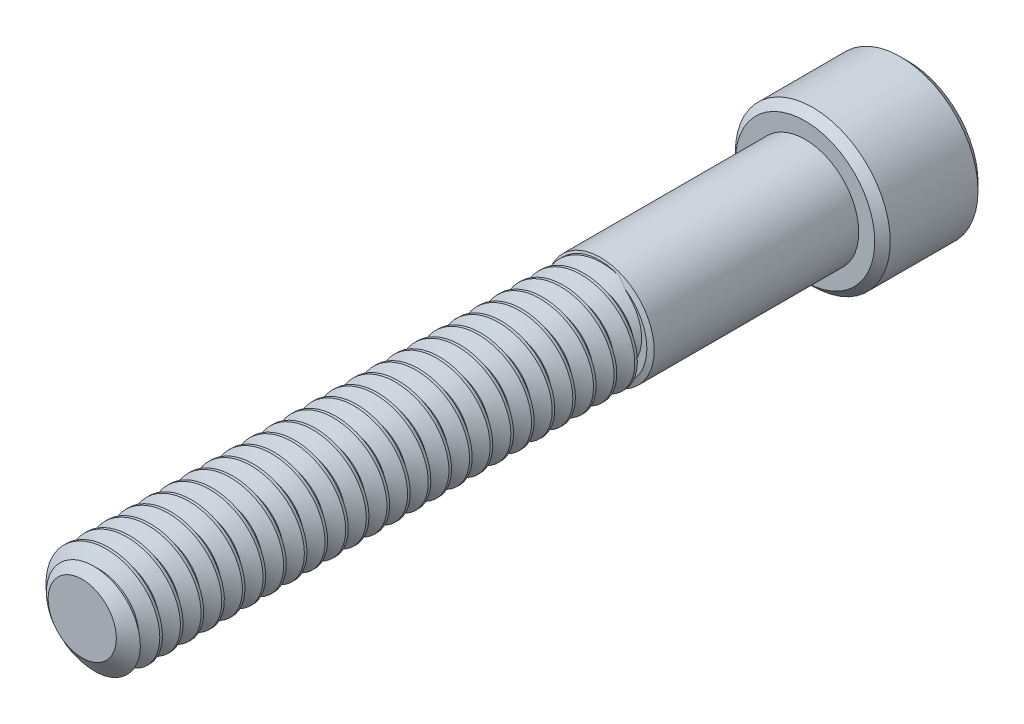
from build123d import *

# Parameters (mm, degrees)
SKETCH1_R          = 3.175
EXTRUDE1_DEPTH     = 44.45
CUT_SWEEP1_PITCH   = 1.27
SKETCH6_R          = 4.7625
EXTRUDE2_DEPTH     = 6.35
CUT_EXTRUDE1_DEPTH = 3.571875
CHAMFER1_SIZE      = 0.47625


with BuildPart() as part:
    # Sketch1 → Extrude1 (new body)
    with BuildSketch(Plane.XY):
        Circle(SKETCH1_R)
    extrude(amount=-EXTRUDE1_DEPTH)

    # Cut-Sweep1: arcs per turn and ends read off the stored shape
    # Cut-Sweep1: the profile of Sketch3 profile screwed along a right-hand helix through 38 turns, 6 arcs to a turn; built about Z, then put on its axis
    cut_sweep1_z = Axis((0, 0, 0), (0, 0, 1))
    cut_sweep1_corners = [(3.1753, 0, -2.381423205), (2.350110803, 0, -1.905), (2.350110803, 0, -1.74625), (3.1753, 0, -1.269826795)]
    with BuildLine(mode=Mode.PRIVATE) as cut_sweep1_profile:
        Line(cut_sweep1_corners[0], cut_sweep1_corners[1])
        Line(cut_sweep1_corners[1], cut_sweep1_corners[2])
        Line(cut_sweep1_corners[2], cut_sweep1_corners[3])
        Line(cut_sweep1_corners[3], cut_sweep1_corners[0])
    cut_sweep1_cap = Face(cut_sweep1_profile.wire())
    cut_sweep1_turn_angles = [0, 30, 60, 90, 120, 150, 180, 210, 240, 270, 300, 330, 360]
    cut_sweep1_turn_weights = [1, 0.8660254037844387, 1, 0.8660254037844387, 1, 0.8660254037844387, 1, 0.8660254037844387, 1, 0.8660254037844387, 1, 0.8660254037844387, 1]
    cut_sweep1_turn_rails = [Edge.make_bspline([Vector(p[0], p[1], 0).rotate(cut_sweep1_z, cut_sweep1_turn_angles[k]) / cut_sweep1_turn_weights[k] + Vector(0, 0, p[2] + CUT_SWEEP1_PITCH * cut_sweep1_turn_angles[k] / 360) for k in range(13)], [0, 0, 0, 1, 1, 2, 2, 3, 3, 4, 4, 5, 5, 6, 6, 6], 2, cut_sweep1_turn_weights) for p in cut_sweep1_corners]
    cut_sweep1_turn_sides = [Face.make_surface_from_curves(cut_sweep1_turn_rails[p[0]], cut_sweep1_turn_rails[p[1]]) for p in [(0, 1), (1, 2), (2, 3), (3, 0)]]
    cut_sweep1 = Plane(origin=(0, 0, 0), x_dir=(0, 1, 0), z_dir=(0, 0, -1)) * Solid(Shell([*[p.moved(Location((0, 0, CUT_SWEEP1_PITCH * i))) for i in range(38) for p in cut_sweep1_turn_sides], cut_sweep1_cap, cut_sweep1_cap.rotate(cut_sweep1_z, 13680).moved(Location((0, 0, CUT_SWEEP1_PITCH * 13680 / 360)))]))
    add(cut_sweep1, mode=Mode.SUBTRACT)

    # Sketch4 → Cut-Revolve1 (revolve, cut)
    with BuildSketch(Plane(origin=(0, 0, 0), x_dir=(0, 0, -1), z_dir=(1, 0, 0)), mode=Mode.PRIVATE) as cut_revolve1_sk:
        Polygon((0.755446349, 3.175), (0, 2.096110803), (0, 3.175), align=None)
    revolve(cut_revolve1_sk.sketch.rotate(Axis((0, 0, 0), (0, 0, -1)), 90), axis=Axis((0, 0, 0), (0, 0, -1)), mode=Mode.SUBTRACT)

    # Sketch5 → partially thread (revolve)
    with BuildSketch(Plane(origin=(0, 0, 0), x_dir=(0, 0, -1), z_dir=(1, 0, 0)), mode=Mode.PRIVATE) as partially_thread_sk:
        Polygon((44.45, 3.302), (31.870182971, 3.302), (31.75, 2.9718), (31.75, 0), (44.45, 0), align=None)
    revolve(partially_thread_sk.sketch.rotate(Axis((0, 0, 0), (0, 0, -1)), 90), axis=Axis((0, 0, 0), (0, 0, -1)))

    # Sketch6 → Extrude2 (add)
    with BuildSketch(Plane(origin=(0, 0, -44.45), x_dir=(-1, 0, 0), z_dir=(0, 0, -1))):
        with Locations(Location((0, 0, 0), (0, 0, 180))):
            Circle(SKETCH6_R)
    extrude(amount=EXTRUDE2_DEPTH)

    # Sketch7 → Cut-Extrude1 (cut)
    with BuildSketch(Plane(origin=(0, 0, -50.8), x_dir=(-1, 0, 0), z_dir=(0, 0, -1))):
        Polygon((0, 2.749630657), (-2.38125, 1.374815329), (-2.38125, -1.374815329), (0, -2.749630657), (2.38125, -1.374815329), (2.38125, 1.374815329), align=None)
    extrude(amount=-CUT_EXTRUDE1_DEPTH, mode=Mode.SUBTRACT)

    # Cut-Extrude2 cone 1 section (through the dimple's axis) → Cut-Extrude2 (revolve, cut)
    with BuildSketch(Plane(origin=(0, 0, -50.8), x_dir=(0, 1, 0), z_dir=(1, 0, 0))):
        Polygon((0, 0), (2.749630657, 0), (0, 2.749630657), align=None)
    revolve(axis=Axis((0, 0, -50.8), (0, 0, 1)), mode=Mode.SUBTRACT)

    # Chamfer1
    chamfer1_edges = [part.edges().sort_by_distance(p)[0] for p in [
        (-4.7625, 0, -44.45),
        (-4.7625, 0, -50.8),
    ]]
    chamfer(chamfer1_edges, length=CHAMFER1_SIZE)


solid = part.part
